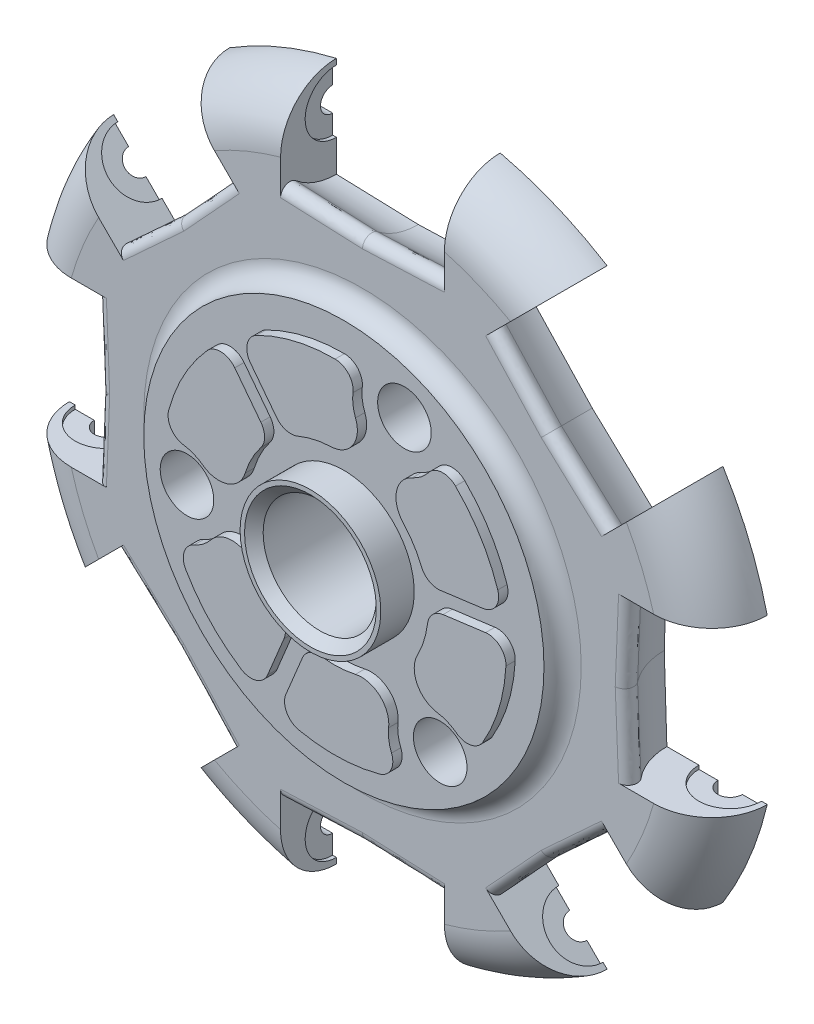
from build123d import *

# Parameters (mm, degrees)
SKETCH1_R                = 30.559375
BOSS_EXTRUDE1_DEPTH      = 4.7625
FILLET1_R                = 4.7625
FILLET2_R                = 0.79375
CIRPATTERN1_COUNT        = 8
FILLET2_OF_CIRPATTERN1_R = 0.79375
SKETCH2_R                = 2.286
CUT_EXTRUDE1_DEPTH       = 43.342080368
SKETCH4_R                = 4.826
CUT_EXTRUDE3_DEPTH       = 43.342080368
SKETCH6_R                = 17.064355
SKETCH6_R_2              = 2.286
SKETCH6_R_3              = 4.826
BOSS_EXTRUDE3_DEPTH      = 1.5875
SKETCH7_R                = 6
SKETCH7_R_2              = 4.826
BOSS_EXTRUDE4_DEPTH      = 2.85
CHAMFER1_SIZE            = 0.79375
BOSS_EXTRUDE5_DEPTH      = 0.79375
CIRPATTERN3_COUNT        = 3
FILLET3_R                = 1.5875


# Read off the part's stored shape, not the designer's step: Cavity2
with BuildPart() as part:
    # Sketch1 → Boss-Extrude1 (new body)
    with BuildSketch(Plane.XY):
        with Locations(Location((0, 0, 0), (0, 0, 180))):
            Circle(SKETCH1_R)
    extrude(amount=BOSS_EXTRUDE1_DEPTH)

    # Fillet1
    fillet1_edges = [part.edges().sort_by_distance(p)[0] for p in [
        (30.559375, 0, 4.7625),
    ]]
    fillet(fillet1_edges, radius=FILLET1_R - 0.0001)  # a hair under: the kernel refuses the full size

    # Cavity2 outline → Cavity2 (revolve, cut)
    with BuildSketch(Plane(origin=(0, 26.590625, 0), x_dir=(0, 1, 0), z_dir=(0, 0, -1))):
        Polygon((1.0414, 9.525), (0, 9.525), (0, -9.525), (1.0414, -9.525), (1.0414, -7.3025), (2.667, -7.3025), (2.667, -6.985), (5.3975, -6.985), (5.61975, 0), (5.397499997, 6.985000084), (2.667, 6.985), (2.667, 7.3025), (1.0414, 7.3025), align=None)
    cavity2 = revolve(axis=Axis((0, 26.590625, 0), (1, 0, 0)), mode=Mode.SUBTRACT)

    # Fillet2
    fillet2_edges = [part.edges().sort_by_distance(p)[0] for p in [
        (3.492921025, 23.822341136, 4.7625),
        (-3.492920983, 23.822341133, 4.7625),
    ]]
    fillet(fillet2_edges, radius=FILLET2_R)

    # CirPattern1: Cavity2 ×8 about axis
    cirpattern1_axis = Axis((0, 0, 4.7625), (0, 0, 1))
    for i in range(1, CIRPATTERN1_COUNT):
        add(cavity2.rotate(cirpattern1_axis, i * 360 / CIRPATTERN1_COUNT), mode=Mode.SUBTRACT)

    # Fillet2 of CirPattern1
    fillet2_of_cirpattern1_edges = [part.edges().sort_by_distance(p)[0] for p in [
        (-14.375070818, 19.314807105, 4.7625),
        (-19.314807073, 14.375070846, 4.7625),
        (-23.822341136, 3.492921025, 4.7625),
        (-23.822341133, -3.492920983, 4.7625),
        (-19.314807105, -14.375070818, 4.7625),
        (-14.375070846, -19.314807073, 4.7625),
        (-3.492921025, -23.822341136, 4.7625),
        (3.492920983, -23.822341133, 4.7625),
        (14.375070818, -19.314807105, 4.7625),
        (19.314807073, -14.375070846, 4.7625),
        (23.822341136, -3.492921025, 4.7625),
        (23.822341133, 3.492920983, 4.7625),
        (19.314807105, 14.375070818, 4.7625),
        (14.375070846, 19.314807073, 4.7625),
    ]]
    fillet(fillet2_of_cirpattern1_edges, radius=FILLET2_OF_CIRPATTERN1_R)

    # Sketch2 → Cut-Extrude1 (cut, through all)
    with BuildSketch(Plane(origin=(0, 0, 0), x_dir=(-1, 0, 0), z_dir=(0, 0, -1))):
        with Locations((-8.214474533, -10.705311636)):
            Circle(SKETCH2_R)
        with Locations((13.378309098, -1.761287806)):
            Circle(SKETCH2_R)
        with Locations((-5.163834565, 12.466599442)):
            Circle(SKETCH2_R)
    extrude(amount=-CUT_EXTRUDE1_DEPTH, mode=Mode.SUBTRACT)

    # Sketch4 → Cut-Extrude3 (cut, through all)
    with BuildSketch(Plane(origin=(0, 0, 0), x_dir=(-1, 0, 0), z_dir=(0, 0, -1))):
        Circle(SKETCH4_R)
    extrude(amount=-CUT_EXTRUDE3_DEPTH, mode=Mode.SUBTRACT)

    # Sketch6 → Boss-Extrude3 (add)
    with BuildSketch(Plane.XY.offset(4.7625)):
        with Locations(Location((0, 0, 0), (0, 0, 180))):
            Circle(SKETCH6_R)
        with Locations(Location((8.214474533, -10.705311636, 0), (0, 0, 180))):
            Circle(SKETCH6_R_2, mode=Mode.SUBTRACT)
        with Locations(Location((-13.378309098, -1.761287806, 0), (0, 0, 180))):
            Circle(SKETCH6_R_2, mode=Mode.SUBTRACT)
        with Locations(Location((0, 0, 0), (0, 0, 180))):
            Circle(SKETCH6_R_3, mode=Mode.SUBTRACT)
        with Locations(Location((5.163834565, 12.466599442, 0), (0, 0, 180))):
            Circle(SKETCH6_R_2, mode=Mode.SUBTRACT)
    extrude(amount=BOSS_EXTRUDE3_DEPTH)

    # Sketch7 → Boss-Extrude4 (add)
    with BuildSketch(Plane.XY.offset(6.35)):
        with Locations(Location((0, 0, 0), (0, 0, 180))):
            Circle(SKETCH7_R)
        with Locations(Location((0, 0, 0), (0, 0, 180))):
            Circle(SKETCH7_R_2, mode=Mode.SUBTRACT)
    extrude(amount=BOSS_EXTRUDE4_DEPTH)

    # Chamfer1
    chamfer1_edges = [part.edges().sort_by_distance(p)[0] for p in [
        (4.826, 0, 9.2),
    ]]
    chamfer(chamfer1_edges, length=CHAMFER1_SIZE)

    # Sketch8 → Boss-Extrude5 (add)
    with BuildSketch(Plane.XY.offset(6.35)):
        with BuildLine():
            Line((9.033405576, 2.041107994), (12.656884062, 2.518147987))
            ThreePointArc((12.656884062, 2.518147987), (13.755767712, 3.221431744), (13.917985925, 4.515973582))
            ThreePointArc((13.917985925, 4.515973582), (12.465098413, 7.663267656), (10.312622652, 10.3804703))
            ThreePointArc((10.312622652, 10.3804703), (9.133227742, 10.823978766), (8.018613513, 10.236350281))
            ThreePointArc((8.018613513, 10.236350281), (7.388654898, 9.607587612), (6.624399458, 9.151403467))
            ThreePointArc((6.624399458, 9.151403467), (5.281797947, 7.490631827), (5.855679618, 5.43359486))
            ThreePointArc((5.855679618, 5.43359486), (6.743387467, 4.2824832), (7.407796719, 2.989562621))
            ThreePointArc((7.407796719, 2.989562621), (8.058416016, 2.237357239), (9.033405576, 2.041107994))
        make_face()
        with BuildLine():
            Line((12.877355854, 0.843498472), (9.253877367, 0.366458479))
            ThreePointArc((9.253877367, 0.366458479), (8.362902813, -0.075449602), (7.929137909, -0.970416872))
            ThreePointArc((7.929137909, -0.970416872), (7.622000324, -2.391244019), (7.062470007, -3.732888197))
            ThreePointArc((7.062470007, -3.732888197), (7.040543223, -5.868364836), (8.767236027, -7.125056214))
            ThreePointArc((8.767236027, -7.125056214), (9.623519239, -7.367892397), (10.394748288, -7.812185211))
            ThreePointArc((10.394748288, -7.812185211), (11.623472401, -8.09130735), (12.647891967, -7.357661204))
            ThreePointArc((12.647891967, -7.357661204), (14.023760102, -4.175943274), (14.612562025, -0.759855687))
            ThreePointArc((14.612562025, -0.759855687), (14.120819182, 0.448590545), (12.877355854, 0.843498472))
        make_face()
    boss_extrude5 = extrude(amount=BOSS_EXTRUDE5_DEPTH)

    # CirPattern3: Boss-Extrude5 ×3 about axis
    cirpattern3_axis = Axis((0, 0, 0), (0, 0, 1))
    for i in range(1, CIRPATTERN3_COUNT):
        add(boss_extrude5.rotate(cirpattern3_axis, i * 360 / CIRPATTERN3_COUNT))

    # Fillet3
    fillet3_edges = [part.edges().sort_by_distance(p)[0] for p in [
        (17.064355, 0, 4.7625),
    ]]
    fillet(fillet3_edges, radius=FILLET3_R - 0.0001)  # a hair under: the kernel refuses the full size


solid = part.part
